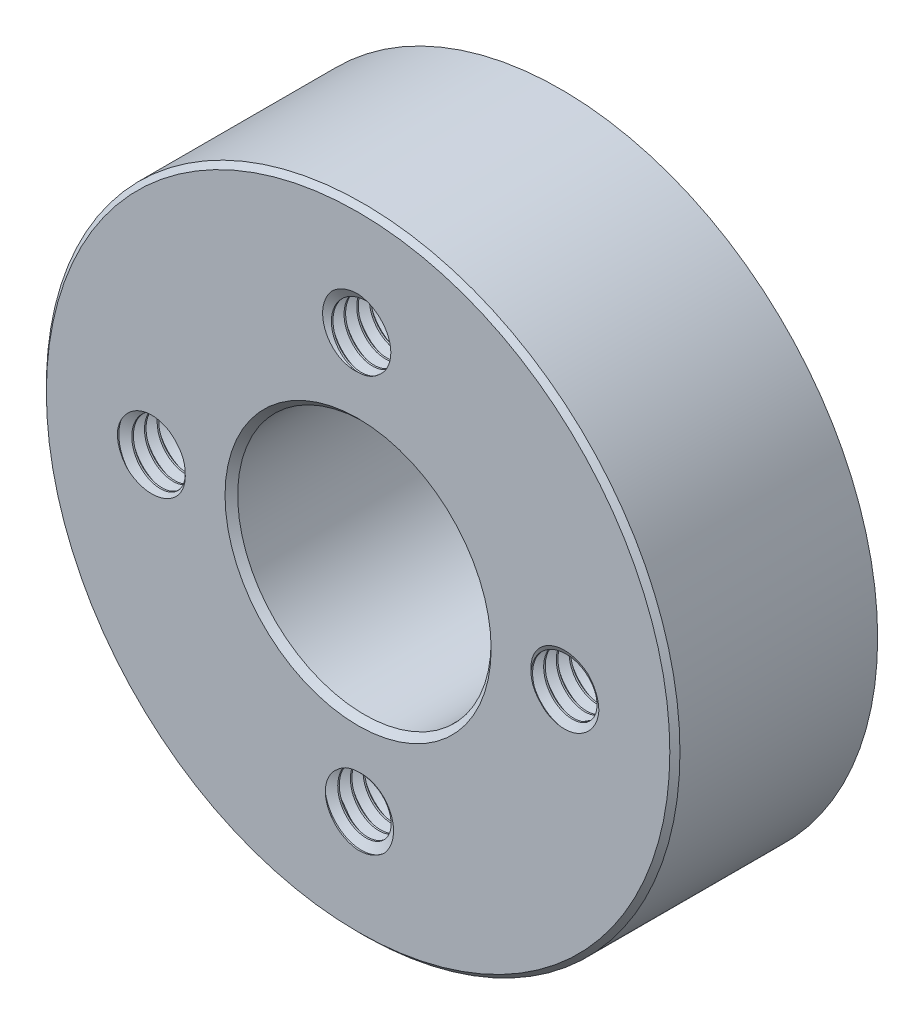
from build123d import *

# Parameters (mm, degrees)
BOSS_EXTRUDE1_DEPTH          = 4
BOSS_EXTRUDE1_DEPTH_BACK     = 4
SKETCH4_R                    = 1.5
CIRPATTERN1_COUNT            = 4
BOSS_EXTRUDE4_DEPTH          = 4
BOSS_EXTRUDE4_DEPTH_BACK     = 4
SKETCH9_R                    = 26
SKETCH9_R_2                  = 5
SKETCH10_R                   = 3.25
CUT_EXTRUDE1_DEPTH           = 3.3
SKETCH11_R                   = 1.7
CUT_EXTRUDE2_DEPTH           = 38.629775444
CHAMFER2_SIZE                = 0.25
CHAMFER1_SIZE                = 0.25
CIRPATTERN2_COUNT            = 6
CHAMFER2_OF_CIRPATTERN2_SIZE = 0.25
SKETCH12_W                   = 1
SKETCH12_H                   = 0.9
SKETCH12_W_2                 = 1.6
SKETCH12_H_2                 = 0.3
SKETCH13_W                   = 0.44
SKETCH13_H                   = 13.05
CIRPATTERN3_COUNT            = 2
CHAMFER3_SIZE                = 0.2
SWEEP1_PITCH                 = 0.5
SKETCH14_R                   = 1.5
CUT_EXTRUDE3_DEPTH           = 5
CUT_EXTRUDE3_DRAFT           = -60
SKETCH15_R                   = 1.5
CUT_EXTRUDE4_DEPTH           = 5
CUT_EXTRUDE4_DRAFT           = -60
CIRPATTERN5_COUNT            = 4
CIRPATTERN5_COPY_1_SKETCH_R  = 1.5
CIRPATTERN5_COPY_1_DEPTH     = 5
CIRPATTERN5_COPY_1_DRAFT     = -60
CIRPATTERN5_COPY_2_SKETCH_R  = 1.5
CIRPATTERN5_COPY_2_DEPTH     = 5
CIRPATTERN5_COPY_2_DRAFT     = -60
CIRPATTERN5_COPY_3_SKETCH_R  = 1.5
CIRPATTERN5_COPY_3_DEPTH     = 5
CIRPATTERN5_COPY_3_DRAFT     = -60
CIRPATTERN5_COPY_4_SKETCH_R  = 1.5
CIRPATTERN5_COPY_4_DEPTH     = 5
CIRPATTERN5_COPY_4_DRAFT     = -60
CIRPATTERN5_COPY_5_SKETCH_R  = 1.5
CIRPATTERN5_COPY_5_DEPTH     = 5
CIRPATTERN5_COPY_5_DRAFT     = -60
CIRPATTERN5_COPY_6_SKETCH_R  = 1.5
CIRPATTERN5_COPY_6_DEPTH     = 5
CIRPATTERN5_COPY_6_DRAFT     = -60
SKETCH16_R                   = 43.360036863
SKETCH16_R_2                 = 12.5
CUT_EXTRUDE5_DEPTH           = 10


with BuildPart() as part:
    # Sketch4 → Boss-Extrude1 (new, two sides: drawn at the far end of the back side and taken through both)
    with BuildSketch(Plane.XY.offset(-BOSS_EXTRUDE1_DEPTH_BACK)):
        with Locations((0, 8)):
            Circle(SKETCH4_R)
    extrude(amount=BOSS_EXTRUDE1_DEPTH + BOSS_EXTRUDE1_DEPTH_BACK)

    # Boss-Extrude2 cone 1 section (through the dimple's axis) → Boss-Extrude2 (revolve)
    with BuildSketch(Plane(origin=(0, 8, 4), x_dir=(0, -1, 0), z_dir=(1, 0, 0))):
        Polygon((0, 0), (1.5, 0), (0, 1.5), align=None)
    revolve(axis=Axis((0, 8, 4), (0, 0, -1)))

    # Boss-Extrude3 cone 1 section (through the dimple's axis) → Boss-Extrude3 (revolve)
    with BuildSketch(Plane(origin=(0, 8, -4), x_dir=(0, 1, 0), z_dir=(1, 0, 0))):
        Polygon((0, 0), (1.5, 0), (0, 1.5), align=None)
    revolve(axis=Axis((0, 8, -4), (0, 0, 1)))


with BuildPart() as cirpattern1_1:
    # CirPattern1: pattern copy
    add(part.part.rotate(Axis((0, 0, 0), (0, 0, 1)), 1 * 360 / CIRPATTERN1_COUNT))


with BuildPart() as cirpattern1_2:
    # CirPattern1: pattern copy
    add(part.part.rotate(Axis((0, 0, 0), (0, 0, 1)), 2 * 360 / CIRPATTERN1_COUNT))


with BuildPart() as cirpattern1_3:
    # CirPattern1: pattern copy
    add(part.part.rotate(Axis((0, 0, 0), (0, 0, 1)), 3 * 360 / CIRPATTERN1_COUNT))


with BuildPart() as body_5:
    # Sketch9 → Boss-Extrude4 (new, two sides: drawn at the far end of the back side and taken through both)
    with BuildSketch(Plane.XY.offset(-BOSS_EXTRUDE4_DEPTH_BACK)):
        Circle(SKETCH9_R)
        Circle(SKETCH9_R_2, mode=Mode.SUBTRACT)
    extrude(amount=BOSS_EXTRUDE4_DEPTH + BOSS_EXTRUDE4_DEPTH_BACK)

    # Combine1: cut CirPattern1_3, CirPattern1_1, CirPattern1_2, part
    add(cirpattern1_3.part, mode=Mode.SUBTRACT)
    add(cirpattern1_1.part, mode=Mode.SUBTRACT)
    add(cirpattern1_2.part, mode=Mode.SUBTRACT)
    add(part.part, mode=Mode.SUBTRACT)

    # Sketch10 → Cut-Extrude1 (cut)
    with BuildSketch(Plane.XY.offset(4)):
        with Locations((0, 21)):
            Circle(SKETCH10_R)
    cut_extrude1 = extrude(amount=-CUT_EXTRUDE1_DEPTH, mode=Mode.SUBTRACT)

    # Sketch11 → Cut-Extrude2 (cut, through all)
    with BuildSketch(Plane.XY.offset(4)):
        with Locations((0, 21)):
            Circle(SKETCH11_R)
    cut_extrude2 = extrude(amount=-CUT_EXTRUDE2_DEPTH, mode=Mode.SUBTRACT)

    # Chamfer2
    chamfer2_edges = [body_5.edges().sort_by_distance(p)[0] for p in [
        (-3.25, 21, 4),
    ]]
    chamfer(chamfer2_edges, length=CHAMFER2_SIZE)

    # Chamfer1
    chamfer1_edges = [body_5.edges().sort_by_distance(p)[0] for p in [
        (-26, 0, -4),
        (-5, 0, -4),
        (-26, 0, 4),
        (-5, 0, 4),
    ]]
    chamfer(chamfer1_edges, length=CHAMFER1_SIZE)

    # CirPattern2: Cut-Extrude1, Cut-Extrude2 ×6 about axis
    cirpattern2_axis = Axis((0, 0, 0), (0, 0, 1))
    add([cut_extrude1.rotate(cirpattern2_axis, i * 360 / CIRPATTERN2_COUNT) for i in range(1, CIRPATTERN2_COUNT)], mode=Mode.SUBTRACT)
    add([cut_extrude2.rotate(cirpattern2_axis, i * 360 / CIRPATTERN2_COUNT) for i in range(1, CIRPATTERN2_COUNT)], mode=Mode.SUBTRACT)

    # Chamfer2 of CirPattern2
    chamfer2_of_cirpattern2_edges = [body_5.edges().sort_by_distance(p)[0] for p in [
        (-19.811533479, 7.685417438, 4),
        (-16.561533479, -13.314582562, 4),
        (3.25, -21, 4),
        (19.811533479, -7.685417438, 4),
        (16.561533479, 13.314582562, 4),
    ]]
    chamfer(chamfer2_of_cirpattern2_edges, length=CHAMFER2_OF_CIRPATTERN2_SIZE)

    # Sketch12 → Cut-Revolve1 (revolve, cut)
    with BuildSketch(Plane(origin=(0, 0, 0), x_dir=(0, 0, -1), z_dir=(1, 0, 0)), mode=Mode.PRIVATE) as cut_revolve1_sk:
        with Locations((-3.5, 12.95)):
            Rectangle(SKETCH12_W, SKETCH12_H)
        with Locations((3.5, 12.95)):
            Rectangle(SKETCH12_W, SKETCH12_H)
        with Locations((0, 25.85)):
            Rectangle(SKETCH12_W_2, SKETCH12_H_2)
    revolve(cut_revolve1_sk.sketch.rotate(Axis((0, 0, 4), (0, 0, -1)), 90), axis=Axis((0, 0, 4), (0, 0, -1)), mode=Mode.SUBTRACT)

    # Sketch13 → Cut-Revolve2 (revolve, cut)
    with BuildSketch(Plane(origin=(0, 0, 0), x_dir=(0, 0, -1), z_dir=(0.866025403784438, -0.500000000000001, 0)), mode=Mode.PRIVATE) as cut_revolve2_sk:
        with Locations((-0.22, 19.475)):
            Rectangle(SKETCH13_W, SKETCH13_H)
    cut_revolve2 = revolve(cut_revolve2_sk.sketch.rotate(Axis((15.488615933, 26.827069736, 0), (-0.5000000000000011, -0.866025403784438, 0)), 90), axis=Axis((15.488615933, 26.827069736, 0), (-0.5000000000000011, -0.866025403784438, 0)), mode=Mode.SUBTRACT)

    # CirPattern3: Cut-Revolve2 ×2 about axis
    cirpattern3_axis = Axis((0, 0, 4), (0, 0, -1))
    for i in range(1, CIRPATTERN3_COUNT):
        add(cut_revolve2.rotate(cirpattern3_axis, i * 360 / CIRPATTERN3_COUNT), mode=Mode.SUBTRACT)

    # Chamfer3
    chamfer3_edges = [body_5.edges().sort_by_distance(p)[0] for p in [
        (-13.4, 0, 4),
        (-12.5, 0, 4),
    ]]
    chamfer(chamfer3_edges, length=CHAMFER3_SIZE)

    # Sweep1: arcs per turn and ends read off the stored shape
    # Sweep1: the profile of Sketch6 profile screwed along a right-hand helix through 17 turns, 6 arcs to a turn; built about Z, then put on its axis
    sweep1_z = Axis((0, 0, 0), (0, 0, 1))
    sweep1_corners = [(1.5003, 0, -0.437673205), (1.5003, 0, 0.000173205), (1.175240474, 0, -0.1875), (1.175240474, 0, -0.25)]
    with BuildLine(mode=Mode.PRIVATE) as sweep1_profile:
        Line(sweep1_corners[0], sweep1_corners[1])
        Line(sweep1_corners[1], sweep1_corners[2])
        Line(sweep1_corners[2], sweep1_corners[3])
        Line(sweep1_corners[3], sweep1_corners[0])
    sweep1_cap = Face(sweep1_profile.wire())
    sweep1_turn_angles = [0, 30, 60, 90, 120, 150, 180, 210, 240, 270, 300, 330, 360]
    sweep1_turn_weights = [1, 0.8660254037844387, 1, 0.8660254037844387, 1, 0.8660254037844387, 1, 0.8660254037844387, 1, 0.8660254037844387, 1, 0.8660254037844387, 1]
    sweep1_turn_rails = [Edge.make_bspline([Vector(p[0], p[1], 0).rotate(sweep1_z, sweep1_turn_angles[k]) / sweep1_turn_weights[k] + Vector(0, 0, p[2] + SWEEP1_PITCH * sweep1_turn_angles[k] / 360) for k in range(13)], [0, 0, 0, 1, 1, 2, 2, 3, 3, 4, 4, 5, 5, 6, 6, 6], 2, sweep1_turn_weights) for p in sweep1_corners]
    sweep1_turn_sides = [Face.make_surface_from_curves(sweep1_turn_rails[p[0]], sweep1_turn_rails[p[1]]) for p in [(0, 1), (1, 2), (2, 3), (3, 0)]]
    sweep1 = Plane(origin=(0, 8, 4), x_dir=(0, 1, 0), z_dir=(0, 0, -1)) * Solid(Shell([*[p.moved(Location((0, 0, SWEEP1_PITCH * i))) for i in range(17) for p in sweep1_turn_sides], sweep1_cap, sweep1_cap.rotate(sweep1_z, 6120).moved(Location((0, 0, SWEEP1_PITCH * 6120 / 360)))]))
    add(sweep1)


with BuildPart() as cut_extrude3_tool:
    # Sketch14 → Cut-Extrude3 (with draft: the straight prism first)
    with BuildSketch(Plane.XY.offset(4)):
        with Locations((0, 8)):
            Circle(SKETCH14_R)
    extrude(amount=CUT_EXTRUDE3_DEPTH)
    # Cut-Extrude3: the draft: its side faces are tilted about the plane it starts from
    cut_extrude3_sides = [cut_extrude3_tool.faces().sort_by_distance(p)[0] for p in [
        (-1.5, 8, 6.5),
    ]]
    draft(cut_extrude3_sides, Plane.XY.offset(4), CUT_EXTRUDE3_DRAFT)


with BuildPart() as body_5_1:
    add(body_5.part)

    # Cut-Extrude3: cut by cut_extrude3_tool
    add(cut_extrude3_tool.part, mode=Mode.SUBTRACT)


with BuildPart() as cut_extrude4_tool:
    # Sketch15 → Cut-Extrude4 (with draft: the straight prism first)
    with BuildSketch(Plane(origin=(0, 0, -4), x_dir=(-1, 0, 0), z_dir=(0, 0, -1))):
        with Locations((0, 8)):
            Circle(SKETCH15_R)
    extrude(amount=CUT_EXTRUDE4_DEPTH)
    # Cut-Extrude4: the draft: its side faces are tilted about the plane it starts from
    cut_extrude4_sides = [cut_extrude4_tool.faces().sort_by_distance(p)[0] for p in [
        (1.5, 8, -6.5),
    ]]
    draft(cut_extrude4_sides, Plane(origin=(0, 0, -4), x_dir=(-1, 0, 0), z_dir=(0, 0, -1)), CUT_EXTRUDE4_DRAFT)


with BuildPart() as body_5_2:
    add(body_5_1.part)

    # Cut-Extrude4: cut by cut_extrude4_tool
    add(cut_extrude4_tool.part, mode=Mode.SUBTRACT)

    # CirPattern5: Sweep1 ×4 about axis
    cirpattern5_axis = Axis((0, 0, 4), (0, 0, 1))
    for i in range(1, CIRPATTERN5_COUNT):
        add(sweep1.rotate(cirpattern5_axis, i * 360 / CIRPATTERN5_COUNT))


with BuildPart() as cirpattern5_copy_1_tool:
    # CirPattern5 copy 1 sketch → CirPattern5 copy 1 (with draft: the straight prism first)
    with BuildSketch(Plane(origin=(0, 0, 4), x_dir=(0, 1, 0), z_dir=(0, 0, 1))):
        with Locations((0, 8)):
            Circle(CIRPATTERN5_COPY_1_SKETCH_R)
    extrude(amount=CIRPATTERN5_COPY_1_DEPTH)
    # CirPattern5 copy 1: the draft: its side faces are tilted about the plane it starts from
    cirpattern5_copy_1_sides = [cirpattern5_copy_1_tool.faces().sort_by_distance(p)[0] for p in [
        (-8, -1.5, 6.5),
    ]]
    draft(cirpattern5_copy_1_sides, Plane(origin=(0, 0, 4), x_dir=(0, 1, 0), z_dir=(0, 0, 1)), CIRPATTERN5_COPY_1_DRAFT)


with BuildPart() as body_5_3:
    add(body_5_2.part)

    # CirPattern5 copy 1: cut by cirpattern5_copy_1_tool
    add(cirpattern5_copy_1_tool.part, mode=Mode.SUBTRACT)


with BuildPart() as cirpattern5_copy_2_tool:
    # CirPattern5 copy 2 sketch → CirPattern5 copy 2 (with draft: the straight prism first)
    with BuildSketch(Plane(origin=(0, 0, 4), x_dir=(-1, 0, 0), z_dir=(0, 0, 1))):
        with Locations((0, 8)):
            Circle(CIRPATTERN5_COPY_2_SKETCH_R)
    extrude(amount=CIRPATTERN5_COPY_2_DEPTH)
    # CirPattern5 copy 2: the draft: its side faces are tilted about the plane it starts from
    cirpattern5_copy_2_sides = [cirpattern5_copy_2_tool.faces().sort_by_distance(p)[0] for p in [
        (1.5, -8, 6.5),
    ]]
    draft(cirpattern5_copy_2_sides, Plane(origin=(0, 0, 4), x_dir=(-1, 0, 0), z_dir=(0, 0, 1)), CIRPATTERN5_COPY_2_DRAFT)


with BuildPart() as body_5_4:
    add(body_5_3.part)

    # CirPattern5 copy 2: cut by cirpattern5_copy_2_tool
    add(cirpattern5_copy_2_tool.part, mode=Mode.SUBTRACT)


with BuildPart() as cirpattern5_copy_3_tool:
    # CirPattern5 copy 3 sketch → CirPattern5 copy 3 (with draft: the straight prism first)
    with BuildSketch(Plane(origin=(0, 0, 4), x_dir=(0, -1, 0), z_dir=(0, 0, 1))):
        with Locations((0, 8)):
            Circle(CIRPATTERN5_COPY_3_SKETCH_R)
    extrude(amount=CIRPATTERN5_COPY_3_DEPTH)
    # CirPattern5 copy 3: the draft: its side faces are tilted about the plane it starts from
    cirpattern5_copy_3_sides = [cirpattern5_copy_3_tool.faces().sort_by_distance(p)[0] for p in [
        (8, 1.5, 6.5),
    ]]
    draft(cirpattern5_copy_3_sides, Plane(origin=(0, 0, 4), x_dir=(0, -1, 0), z_dir=(0, 0, 1)), CIRPATTERN5_COPY_3_DRAFT)


with BuildPart() as body_5_5:
    add(body_5_4.part)

    # CirPattern5 copy 3: cut by cirpattern5_copy_3_tool
    add(cirpattern5_copy_3_tool.part, mode=Mode.SUBTRACT)


with BuildPart() as cirpattern5_copy_4_tool:
    # CirPattern5 copy 4 sketch → CirPattern5 copy 4 (with draft: the straight prism first)
    with BuildSketch(Plane(origin=(0, 0, -4), x_dir=(0, -1, 0), z_dir=(0, 0, -1))):
        with Locations((0, 8)):
            Circle(CIRPATTERN5_COPY_4_SKETCH_R)
    extrude(amount=CIRPATTERN5_COPY_4_DEPTH)
    # CirPattern5 copy 4: the draft: its side faces are tilted about the plane it starts from
    cirpattern5_copy_4_sides = [cirpattern5_copy_4_tool.faces().sort_by_distance(p)[0] for p in [
        (-8, 1.5, -6.5),
    ]]
    draft(cirpattern5_copy_4_sides, Plane(origin=(0, 0, -4), x_dir=(0, -1, 0), z_dir=(0, 0, -1)), CIRPATTERN5_COPY_4_DRAFT)


with BuildPart() as body_5_6:
    add(body_5_5.part)

    # CirPattern5 copy 4: cut by cirpattern5_copy_4_tool
    add(cirpattern5_copy_4_tool.part, mode=Mode.SUBTRACT)


with BuildPart() as cirpattern5_copy_5_tool:
    # CirPattern5 copy 5 sketch → CirPattern5 copy 5 (with draft: the straight prism first)
    with BuildSketch(Plane(origin=(0, 0, -4), x_dir=(1, 0, 0), z_dir=(0, 0, -1))):
        with Locations((0, 8)):
            Circle(CIRPATTERN5_COPY_5_SKETCH_R)
    extrude(amount=CIRPATTERN5_COPY_5_DEPTH)
    # CirPattern5 copy 5: the draft: its side faces are tilted about the plane it starts from
    cirpattern5_copy_5_sides = [cirpattern5_copy_5_tool.faces().sort_by_distance(p)[0] for p in [
        (-1.5, -8, -6.5),
    ]]
    draft(cirpattern5_copy_5_sides, Plane(origin=(0, 0, -4), x_dir=(1, 0, 0), z_dir=(0, 0, -1)), CIRPATTERN5_COPY_5_DRAFT)


with BuildPart() as body_5_7:
    add(body_5_6.part)

    # CirPattern5 copy 5: cut by cirpattern5_copy_5_tool
    add(cirpattern5_copy_5_tool.part, mode=Mode.SUBTRACT)


with BuildPart() as cirpattern5_copy_6_tool:
    # CirPattern5 copy 6 sketch → CirPattern5 copy 6 (with draft: the straight prism first)
    with BuildSketch(Plane.YX.offset(4)):
        with Locations((0, 8)):
            Circle(CIRPATTERN5_COPY_6_SKETCH_R)
    extrude(amount=CIRPATTERN5_COPY_6_DEPTH)
    # CirPattern5 copy 6: the draft: its side faces are tilted about the plane it starts from
    cirpattern5_copy_6_sides = [cirpattern5_copy_6_tool.faces().sort_by_distance(p)[0] for p in [
        (8, -1.5, -6.5),
    ]]
    draft(cirpattern5_copy_6_sides, Plane.YX.offset(4), CIRPATTERN5_COPY_6_DRAFT)


with BuildPart() as body_5_8:
    add(body_5_7.part)

    # CirPattern5 copy 6: cut by cirpattern5_copy_6_tool
    add(cirpattern5_copy_6_tool.part, mode=Mode.SUBTRACT)

    # Sketch16 → Cut-Extrude5 (cut)
    with BuildSketch(Plane.XY.offset(4)):
        Circle(SKETCH16_R)
        Circle(SKETCH16_R_2, mode=Mode.SUBTRACT)
    extrude(amount=-CUT_EXTRUDE5_DEPTH, mode=Mode.SUBTRACT)


solid = body_5_8.part
